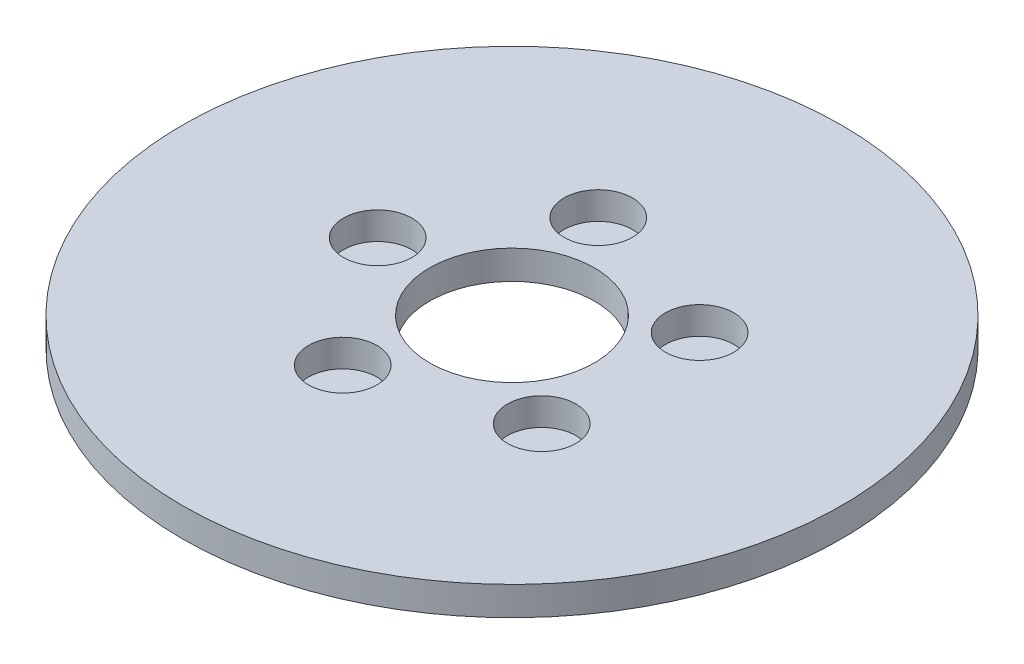
from build123d import *

# Parameters (mm, degrees)
SKETCH1_R           = 80
BOSS_EXTRUDE1_DEPTH = 7
SKETCH2_R           = 20
CUT_EXTRUDE1_DEPTH  = 114.353429591
SKETCH3_R           = 8.306073259
CUT_EXTRUDE2_DEPTH  = 6.658091367
CIRPATTERN1_COUNT   = 5


with BuildPart() as part:
    # Sketch1 → Boss-Extrude1 (new body)
    with BuildSketch(Plane(origin=(0, 0, 0), x_dir=(1, 0, 0), z_dir=(0, 1, 0))):
        Circle(SKETCH1_R)
    extrude(amount=BOSS_EXTRUDE1_DEPTH)

    # Sketch2 → Cut-Extrude1 (cut, through all)
    with BuildSketch(Plane(origin=(0, 0, 0), x_dir=(1, 0, 0), z_dir=(0, 1, 0))):
        Circle(SKETCH2_R)
    extrude(amount=CUT_EXTRUDE1_DEPTH, mode=Mode.SUBTRACT)

    # Sketch3 → Cut-Extrude2 (cut)
    with BuildSketch(Plane(origin=(0, 7, 0), x_dir=(1, 0, 0), z_dir=(0, 1, 0))):
        with Locations((-32.610543727, 0)):
            Circle(SKETCH3_R)
    cut_extrude2 = extrude(amount=-CUT_EXTRUDE2_DEPTH, mode=Mode.SUBTRACT)

    # CirPattern1: Cut-Extrude2 ×5 about axis
    cirpattern1_axis = Axis((0, 0, 0), (0, 1, 0))
    for i in range(1, CIRPATTERN1_COUNT):
        add(cut_extrude2.rotate(cirpattern1_axis, i * 360 / CIRPATTERN1_COUNT), mode=Mode.SUBTRACT)


solid = part.part
